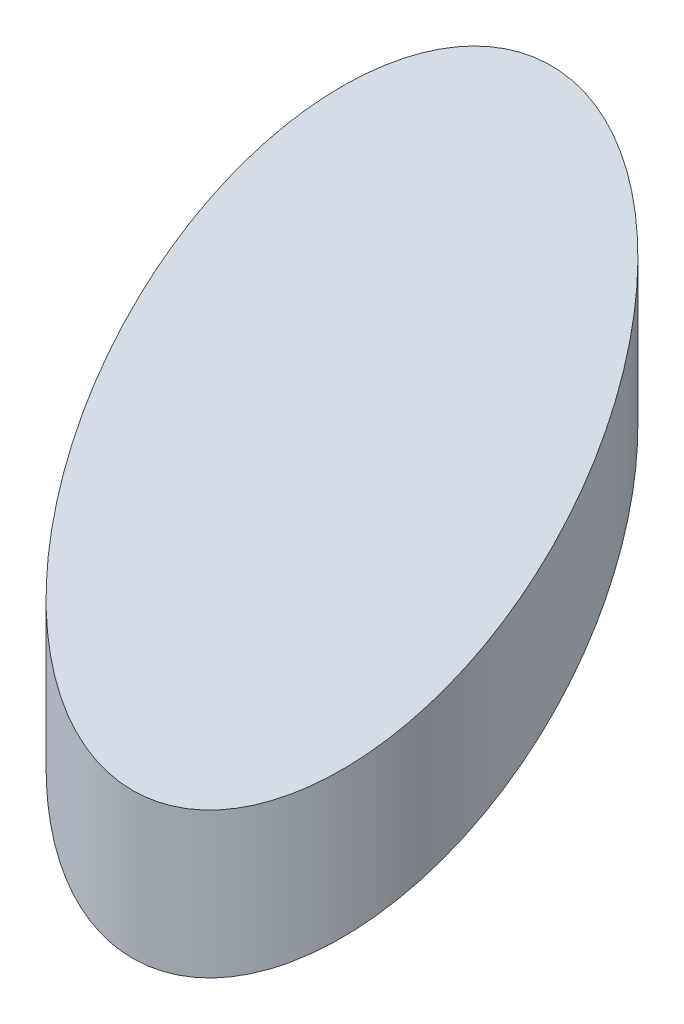
from build123d import *

# Parameters (mm, degrees)
SKETCH2_R               = 27.5
BOSS_EXTRUDE1_DEPTH     = 80
CUT_EXTRUDE2_DEPTH      = 89.952234373
CUT_EXTRUDE2_DEPTH_BACK = 89.952234373


with BuildPart() as part:
    # Sketch2 → Boss-Extrude1 (new body)
    with BuildSketch(Plane(origin=(0, 0, 0), x_dir=(1, 0, 0), z_dir=(0, 1, 0))):
        Circle(SKETCH2_R)
    extrude(amount=BOSS_EXTRUDE1_DEPTH)

    # Sketch3 → Cut-Extrude2 (cut, two sides: drawn at the far end of the back side and taken through both)
    with BuildSketch(Plane(origin=(0, 0, 0), x_dir=(0, 0, -1), z_dir=(1, 0, 0)).offset(-CUT_EXTRUDE2_DEPTH_BACK)):
        Polygon((27.5, 80), (-27.5, 80), (-27.5, 19.109985026), (27.5, 74.109985026), align=None)
        Polygon((27.5, 0), (27.5, 55), (-27.5, 0), align=None)
    extrude(amount=CUT_EXTRUDE2_DEPTH + CUT_EXTRUDE2_DEPTH_BACK, mode=Mode.SUBTRACT)


solid = part.part
